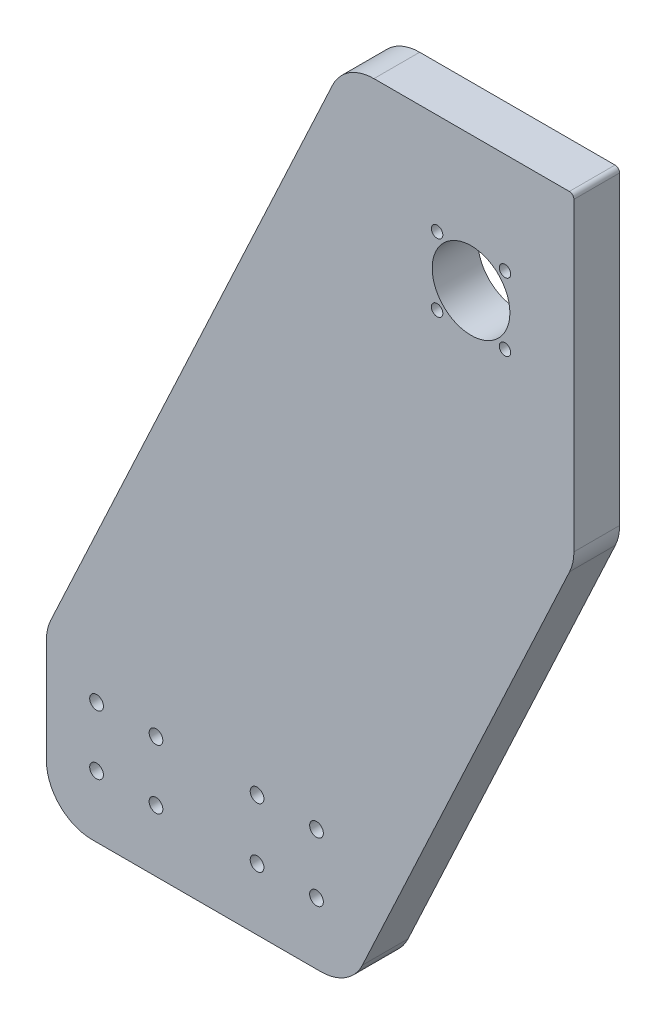
from build123d import *

# Parameters (mm, degrees)
SCHIZZO1_R                   = 3
SCHIZZO1_R_2                 = 17
SCHIZZO1_R_3                 = 2.5
ESTRUSIONE_ESTRUSIONE2_DEPTH = 20
SCHIZZO2_R                   = 2
TAGLIO_ESTRUSIONE1_DEPTH     = 15


with BuildPart() as part:
    # Schizzo1 → Estrusione-Estrusione2 (new body)
    with BuildSketch(Plane.XY):
        with BuildLine():
            Line((20, 0), (120.123746557, 0))
            ThreePointArc((120.123746557, 0), (130.869738724, 3.132171084), (138.249902298, 11.547634765))
            Line((138.249902298, 11.547634765), (228.915915727, 205.981528018))
            ThreePointArc((228.915915727, 205.981528018), (230.315680128, 210.105100974), (230.789759986, 214.433893253))
            Line((230.789759986, 214.433893253), (230.789759986, 348))
            ThreePointArc((230.789759986, 348), (230.203973548, 349.414213562), (228.789759986, 350))
            Line((228.789759986, 350), (143.3075495, 350))
            ThreePointArc((143.3075495, 350), (132.561557333, 346.867828916), (125.181393759, 338.452365235))
            Line((125.181393759, 338.452365235), (1.873844259, 74.018471982))
            ThreePointArc((1.873844259, 74.018471982), (0.474079858, 69.894899026), (0, 65.566106747))
            Line((0, 65.566106747), (0, 20))
            ThreePointArc((0, 20), (5.857864376, 5.857864376), (20, 0))
        make_face()
        with Locations((92.175585503, 53)):
            Circle(SCHIZZO1_R, mode=Mode.SUBTRACT)
        with Locations((118.175585503, 53)):
            Circle(SCHIZZO1_R, mode=Mode.SUBTRACT)
        with Locations((118.175585503, 27)):
            Circle(SCHIZZO1_R, mode=Mode.SUBTRACT)
        with Locations((92.175585503, 27)):
            Circle(SCHIZZO1_R, mode=Mode.SUBTRACT)
        with Locations((185.789759986, 290.962307314)):
            Circle(SCHIZZO1_R_2, mode=Mode.SUBTRACT)
        with Locations((200.639002391, 305.811549718)):
            Circle(SCHIZZO1_R_3, mode=Mode.SUBTRACT)
        with Locations((200.639002391, 276.113064909)):
            Circle(SCHIZZO1_R_3, mode=Mode.SUBTRACT)
        with Locations((170.940517581, 276.113064909)):
            Circle(SCHIZZO1_R_3, mode=Mode.SUBTRACT)
        with Locations((170.940517581, 305.811549718)):
            Circle(SCHIZZO1_R_3, mode=Mode.SUBTRACT)
        with Locations((47.948161054, 27)):
            Circle(SCHIZZO1_R, mode=Mode.SUBTRACT)
        with Locations((21.948161054, 27)):
            Circle(SCHIZZO1_R, mode=Mode.SUBTRACT)
        with Locations((21.948161054, 53)):
            Circle(SCHIZZO1_R, mode=Mode.SUBTRACT)
        with Locations((47.948161054, 53)):
            Circle(SCHIZZO1_R, mode=Mode.SUBTRACT)
    extrude(amount=-ESTRUSIONE_ESTRUSIONE2_DEPTH)

    # Schizzo2 → Taglio-Estrusione1 (cut)
    with BuildSketch(Plane.XZ):
        with Locations((70.061873279, -10)):
            Circle(SCHIZZO2_R)
        with Locations((97.561873279, -10)):
            Circle(SCHIZZO2_R)
        with Locations((42.561873279, -10)):
            Circle(SCHIZZO2_R)
    extrude(amount=-TAGLIO_ESTRUSIONE1_DEPTH, mode=Mode.SUBTRACT)


solid = part.part
